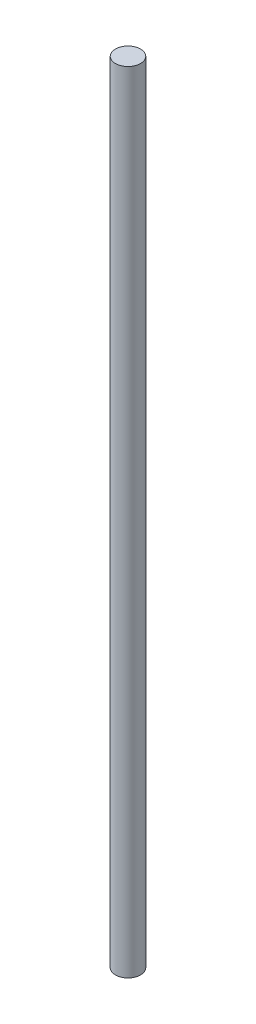
from build123d import *

# Parameters (mm, degrees)
SKETCH_1_R      = 2.5
EXTRUDE_1_DEPTH = 157


with BuildPart() as part:
    # Эскиз1 → Вытянуть1 (new body)
    with BuildSketch(Plane(origin=(0, 0, 0), x_dir=(1, 0, 0), z_dir=(0, 1, 0))):
        Circle(SKETCH_1_R)
    extrude(amount=EXTRUDE_1_DEPTH)


solid = part.part
